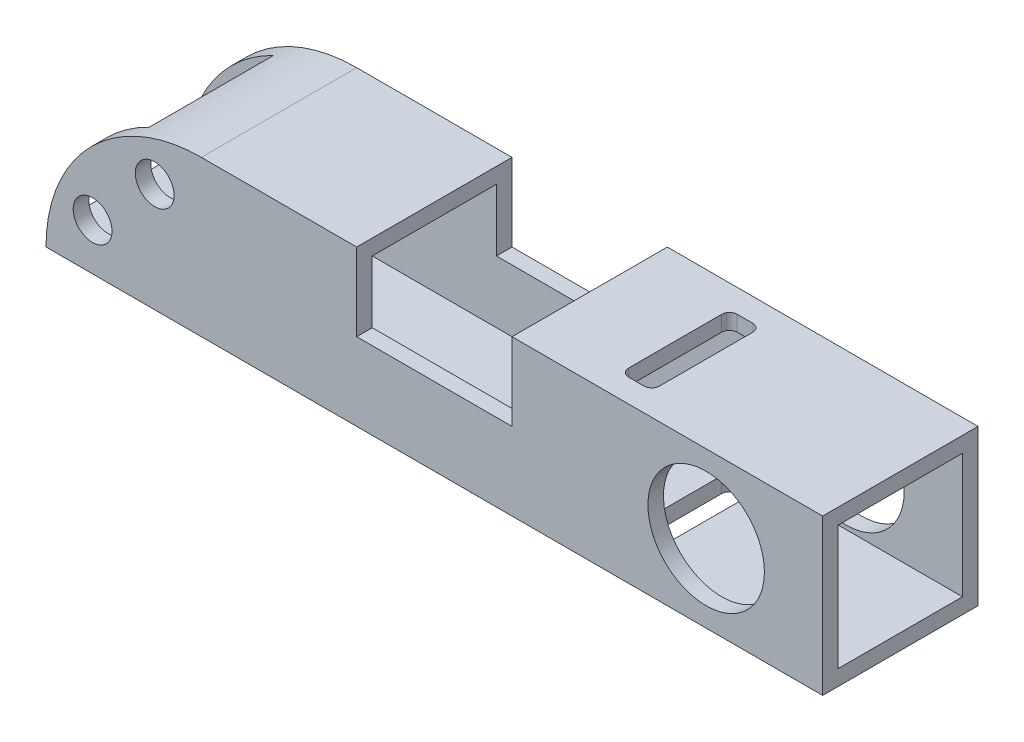
from build123d import *

# Parameters (mm, degrees)
SKETCH1_W           = 25.4
SKETCH1_H           = 25.4
SKETCH1_W_2         = 20.32
SKETCH1_H_2         = 20.32
BOSS_EXTRUDE1_DEPTH = 127
SKETCH2_W           = 25.4
SKETCH2_H           = 12.7
CUT_EXTRUDE1_DEPTH  = 127
FILLET1_R           = 25.4
SKETCH3_R           = 3.175
CUT_EXTRUDE2_DEPTH  = 127
SKETCH4_R           = 9.525
CUT_EXTRUDE3_DEPTH  = 127
CUT_EXTRUDE4_DEPTH  = 127


with BuildPart() as part:
    # Sketch1 → Boss-Extrude1 (new body)
    with BuildSketch(Plane(origin=(0, 0, 0), x_dir=(0, 0, -1), z_dir=(1, 0, 0))):
        with Locations((12.7, 12.7)):
            Rectangle(SKETCH1_W, SKETCH1_H)
        with Locations((12.7, 12.7)):
            Rectangle(SKETCH1_W_2, SKETCH1_H_2, mode=Mode.SUBTRACT)
    extrude(amount=BOSS_EXTRUDE1_DEPTH)

    # Sketch2 → Cut-Extrude1 (cut)
    with BuildSketch(Plane.XY):
        with Locations((63.5, 19.05)):
            Rectangle(SKETCH2_W, SKETCH2_H)
    extrude(amount=-CUT_EXTRUDE1_DEPTH, mode=Mode.SUBTRACT)

    # Fillet1
    # the kernel refuses this fillet: 25.4 mm, written as the material it takes off along each edge
    with BuildSketch(Plane(origin=(0, 25.4, -88.9), x_dir=(0, -1, 0), z_dir=(0, 0, 1))) as fillet1_piece_1:
        with BuildLine():
            CenterArc((FILLET1_R, FILLET1_R), FILLET1_R, 180, 90)
            Line((0, FILLET1_R), (0, 0))
            Line((0, 0), (FILLET1_R, 0))
        make_face()
    extrude(amount=152.4, mode=Mode.SUBTRACT)

    # Sketch3 → Cut-Extrude2 (cut)
    with BuildSketch(Plane.XY):
        with Locations((7.62, 7.62)):
            Circle(SKETCH3_R)
        with Locations((17.78, 17.78)):
            Circle(SKETCH3_R)
    extrude(amount=-CUT_EXTRUDE2_DEPTH, mode=Mode.SUBTRACT)

    # Sketch4 → Cut-Extrude3 (cut)
    with BuildSketch(Plane.XY):
        with Locations((107.95, 12.7)):
            Circle(SKETCH4_R)
    extrude(amount=-CUT_EXTRUDE3_DEPTH, mode=Mode.SUBTRACT)

    # Sketch5 → Cut-Extrude4 (cut)
    with BuildSketch(Plane.XZ):
        with BuildLine():
            Line((91.44, -3.81), (93.98, -3.81))
            ThreePointArc((93.98, -3.81), (94.878025612, -4.181974388), (95.25, -5.08))
            Line((95.25, -5.08), (95.25, -20.32))
            ThreePointArc((95.25, -20.32), (94.878025612, -21.218025612), (93.98, -21.59))
            Line((93.98, -21.59), (91.44, -21.59))
            ThreePointArc((91.44, -21.59), (90.541974388, -21.218025612), (90.17, -20.32))
            Line((90.17, -20.32), (90.17, -5.08))
            ThreePointArc((90.17, -5.08), (90.541974388, -4.181974388), (91.44, -3.81))
        make_face()
    extrude(amount=-CUT_EXTRUDE4_DEPTH, mode=Mode.SUBTRACT)


solid = part.part
